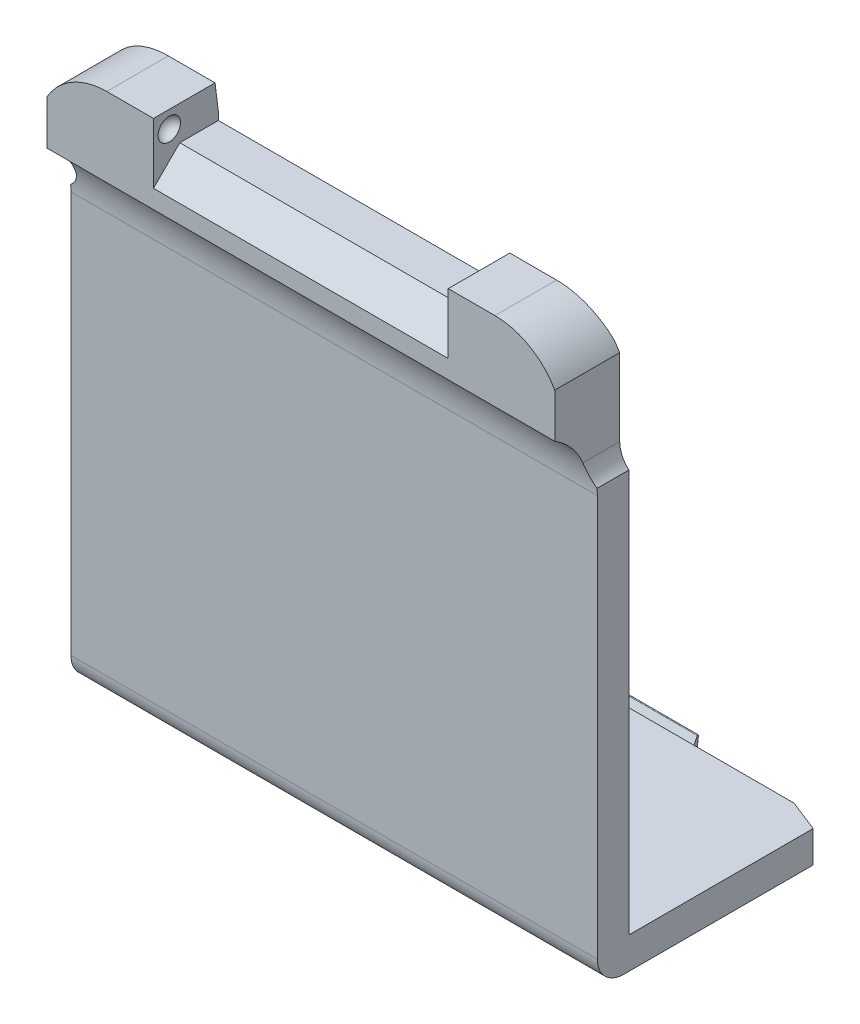
from build123d import *

# Parameters (mm, degrees)
SKETCH1_W                = 40
SKETCH1_H                = 40.6
BOSS_EXTRUDE1_DEPTH      = 2.4
SKETCH2_W                = 40
SKETCH2_H                = 2.4
BOSS_EXTRUDE2_DEPTH      = 17.35
SKETCH3_W                = 22.4
SKETCH3_H                = 2.6
CUT_EXTRUDE1_DEPTH       = 2.4
BOSS_EXTRUDE3_DEPTH      = 2.53
FILLET1_R                = 5.25
FILLET2_R                = 5.25
CUT_EXTRUDE2_DEPTH       = 16.4
FILLET3_R                = 2
CUT_EXTRUDE3_DEPTH       = 59.922512676
BOSS_EXTRUDE4_DEPTH      = 10
BOSS_EXTRUDE4_DEPTH_BACK = 10
FILLET4_R                = 0.05
CHAMFER1_SIZE            = 2
SKETCH9_W                = 0.7
SKETCH9_H                = 10
CUT_EXTRUDE4_DEPTH       = 60.009057176
FILLET5_R                = 2


with BuildPart() as part:
    # Sketch1 → Boss-Extrude1 (new body)
    with BuildSketch(Plane.XY):
        with Locations((20, 20.3)):
            Rectangle(SKETCH1_W, SKETCH1_H)
    extrude(amount=BOSS_EXTRUDE1_DEPTH)

    # Sketch2 → Boss-Extrude2 (add)
    with BuildSketch(Plane.XY.offset(2.4)):
        with Locations((20, -1.2)):
            Rectangle(SKETCH2_W, SKETCH2_H)
    extrude(amount=-BOSS_EXTRUDE2_DEPTH)

    # Sketch3 → Cut-Extrude1 (cut)
    with BuildSketch(Plane.XY.offset(2.4)):
        with Locations((20, 39.3)):
            Rectangle(SKETCH3_W, SKETCH3_H)
    extrude(amount=-CUT_EXTRUDE1_DEPTH, mode=Mode.SUBTRACT)

    # Sketch5 → Boss-Extrude3 (add)
    with BuildSketch(Plane.XY.offset(2.4)):
        Polygon((0, 40.6), (0, 34.6), (40, 34.6), (40, 40.6), (31.2, 40.6), (31.2, 38), (8.8, 38), (8.8, 40.6), align=None)
    extrude(amount=BOSS_EXTRUDE3_DEPTH)

    # Sketch4 → Cut-Revolve2 (revolve, cut)
    with BuildSketch(Plane(origin=(8.8, 0, 0), x_dir=(0, 0, -1), z_dir=(1, 0, 0))):
        with BuildLine():
            Line((-2.88, 39.3), (-4.58, 39.3))
            ThreePointArc((-4.58, 39.3), (-3.73, 38.45), (-2.88, 39.3))
        make_face()
    cut_revolve2 = revolve(axis=Axis((8.8, 39.3, 2.88), (0, 0, 1)), mode=Mode.SUBTRACT)

    # Mirror2: Cut-Revolve2 across plane
    add(cut_revolve2.mirror(Plane.ZY.offset(-20)), mode=Mode.SUBTRACT)

    # Fillet1
    fillet1_edges = [part.edges().sort_by_distance(p)[0] for p in [
        (0, 40.6, 2.465),
        (40, 40.6, 2.465),
    ]]
    fillet(fillet1_edges, radius=FILLET1_R)

    # Fillet2
    # the kernel refuses this fillet: 5.25 mm, written as the material it adds along each edge
    with BuildSketch(Plane(origin=(0, 34.6, 2.4), x_dir=(0, 0, 1), z_dir=(1, 0, 0))) as fillet2_piece_1:
        with BuildLine():
            CenterArc((5.25, 4.490445412), FILLET2_R, 180, 58.795429652)
            Line((0, 4.490445412), (-0.105, 4.490445412))
            Line((-0.105, 4.490445412), (-0.105, 0))
            Line((-0.105, 0), (0, -0.105))
            ThreePointArc((0, -0.105), (1.265, -0.105), (2.4756, -0.089808908))
            Line((2.4756, -0.089808908), (2.53, 0))
        make_face()
    extrude(amount=40)

    # Sketch6 → Cut-Extrude2 (cut)
    with BuildSketch(Plane.ZY.offset(-31.2)):
        Polygon((0, 40.6), (0, 38.6), (0.25, 40.6), align=None)
    cut_extrude2 = extrude(amount=-CUT_EXTRUDE2_DEPTH, mode=Mode.SUBTRACT)

    # Mirror3: Cut-Extrude2 across plane
    add(cut_extrude2.mirror(Plane.ZY.offset(-20)), mode=Mode.SUBTRACT)

    # Fillet3
    fillet3_edges = [part.edges().sort_by_distance(p)[0] for p in [
        (20, -2.4, 2.4),
    ]]
    fillet(fillet3_edges, radius=FILLET3_R)

    # Sketch7 → Cut-Extrude3 (cut, through all)
    with BuildSketch(Plane(origin=(0, 0, 0), x_dir=(1, 0, 0), z_dir=(0, 1, 0))):
        Polygon((37.6, 14.952), (40, 14), (40, 14.95), align=None)
    extrude(amount=-CUT_EXTRUDE3_DEPTH, mode=Mode.SUBTRACT)

    # Sketch8 → Boss-Extrude4 (add, two sides: drawn at the far end of the back side and taken through both)
    with BuildSketch(Plane.ZY.offset(-20).offset(-BOSS_EXTRUDE4_DEPTH_BACK)):
        Polygon((-14.95, 0), (-15.323046127, 0.8), (-14.95, -2.4), align=None)
    extrude(amount=BOSS_EXTRUDE4_DEPTH + BOSS_EXTRUDE4_DEPTH_BACK)

    # Fillet4
    fillet4_edges = [part.edges().sort_by_distance(p)[0] for p in [
        (20, 0.8, -15.323046127),
    ]]
    fillet(fillet4_edges, radius=FILLET4_R)

    # Chamfer1
    chamfer1_edges = [part.edges().sort_by_distance(p)[0] for p in [
        (20, 38, 4.93),
    ]]
    chamfer(chamfer1_edges, length=CHAMFER1_SIZE)

    # Sketch9 → Cut-Extrude4 (cut, through all)
    with BuildSketch(Plane(origin=(0, 0, 0), x_dir=(-1, 0, 0), z_dir=(0, 0, -1))):
        with Locations((-39.65, 35.6)):
            Rectangle(SKETCH9_W, SKETCH9_H)
        with Locations((-0.35, 35.6)):
            Rectangle(SKETCH9_W, SKETCH9_H)
    extrude(amount=-CUT_EXTRUDE4_DEPTH, mode=Mode.SUBTRACT)

    # Fillet5
    # the kernel refuses this fillet: 2 mm, written as the material it adds along each edge
    with BuildSketch(Plane(origin=(0.7, 30.6, 0), x_dir=(0, 1, 0), z_dir=(0, 0, 1))) as fillet5_piece_1_section:
        with BuildLine():
            CenterArc((1.519868415, 2), FILLET5_R, 220.541601874, 49.458398126)
            Line((0, 0.7), (-0.030397368, 0.674))
            ThreePointArc((-0.030397368, 0.674), (-0.04, 0.35), (-0.04, 0))
            Line((-0.04, 0), (0, -0.04))
            Line((0, -0.04), (1.519868415, -0.04))
            Line((1.519868415, -0.04), (1.519868415, 0))
        make_face()
    fillet5_piece_1 = extrude(amount=6.222629495, mode=Mode.PRIVATE)
    fillet5_piece_1 = fillet5_piece_1 - Plane(origin=(0.526032061, 30.109554588, 7.65), x_dir=(0, 0, 1), z_dir=(-1, 0, 0)) * Cylinder(5.25, 19, mode=Mode.PRIVATE)
    add(fillet5_piece_1)
    with BuildSketch(Plane(origin=(39.3, 30.6, 0), x_dir=(0, 1, 0), z_dir=(0, 0, 1))) as fillet5_piece_2_section:
        with BuildLine():
            CenterArc((1.519868415, -2), FILLET5_R, 90, 49.458398126)
            Line((0, -0.7), (-0.030397368, -0.674))
            ThreePointArc((-0.030397368, -0.674), (-0.04, -0.35), (-0.04, 0))
            Line((-0.04, 0), (0, 0.04))
            Line((0, 0.04), (1.519868415, 0.04))
            Line((1.519868415, 0.04), (1.519868415, 0))
        make_face()
    fillet5_piece_2 = extrude(amount=6.222629495, mode=Mode.PRIVATE)
    fillet5_piece_2 = fillet5_piece_2 - Plane(origin=(39.473967939, 30.109554588, 7.65), x_dir=(0, 0, 1), z_dir=(-1, 0, 0)) * Cylinder(5.25, 19, mode=Mode.PRIVATE)
    add(fillet5_piece_2)


solid = part.part
